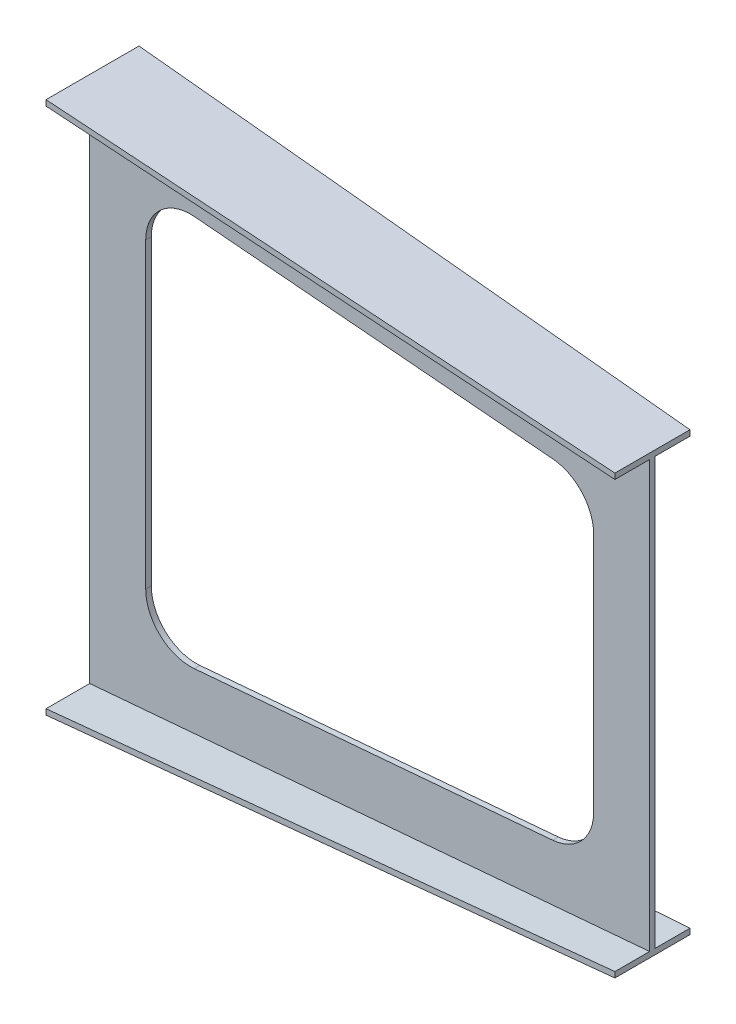
from build123d import *

# Parameters (mm, degrees)
CUT_EXTRUDE1_DEPTH = 1111.999550096


with BuildPart() as part:
    # Sketch1 → Loft l2 section 0
    with BuildSketch(Plane(origin=(0, 0, 0), x_dir=(0, 0, -1), z_dir=(1, 0, 0))):
        with BuildLine():
            Line((-88, 476), (78, 476))
            Line((78, 476), (78, 466))
            Line((78, 466), (0, 466))
            Line((0, 466), (0, -466))
            Line((0, -466), (78, -466))
            Line((78, -466), (78, -476))
            Line((78, -476), (-88, -476))
            Line((-88, -476), (-88, -466))
            Line((-88, -466), (-10, -466))
            Line((-10, -466), (-10, 466))
            Line((-10, 466), (-88, 466))
            Line((-88, 466), (-88, 476))
        make_face()
    # Sketch4 → Loft l2 section 1
    with BuildSketch(Plane(origin=(1000, 0, -1000), x_dir=(0, 0, 1), z_dir=(-1, 0, 0))):
        with BuildLine():
            Line((938, 390.5), (1072, 390.5))
            Line((1072, 390.5), (1072, 380.5))
            Line((1072, 380.5), (1010, 380.5))
            Line((1010, 380.5), (1010, -380.5))
            Line((1010, -380.5), (1072, -380.5))
            Line((1072, -380.5), (1072, -390.5))
            Line((1072, -390.5), (938, -390.5))
            Line((938, -390.5), (938, -380.5))
            Line((938, -380.5), (1000, -380.5))
            Line((1000, -380.5), (1000, 380.5))
            Line((1000, 380.5), (938, 380.5))
            Line((938, 380.5), (938, 390.5))
        make_face()
    loft()

    # Sketch6 → Cut-Extrude1 (cut, through all)
    with BuildSketch(Plane.XY.offset(10)):
        with BuildLine():
            Line((186.815135188, -349.662459008), (826.815135188, -294.942459008))
            ThreePointArc((826.815135188, -294.942459008), (878.928816444, -269.338678138), (900, -215.23327552))
            Line((900, -215.23327552), (900, 215.23327552))
            ThreePointArc((900, 215.23327552), (878.928816444, 269.338678138), (826.815135188, 294.942459008))
            Line((826.815135188, 294.942459008), (186.815135188, 349.662459008))
            ThreePointArc((186.815135188, 349.662459008), (125.894597382, 328.882091964), (100, 269.95327552))
            Line((100, 269.95327552), (100, -269.95327552))
            ThreePointArc((100, -269.95327552), (125.894597382, -328.882091964), (186.815135188, -349.662459008))
        make_face()
    extrude(amount=-CUT_EXTRUDE1_DEPTH, mode=Mode.SUBTRACT)


solid = part.part
